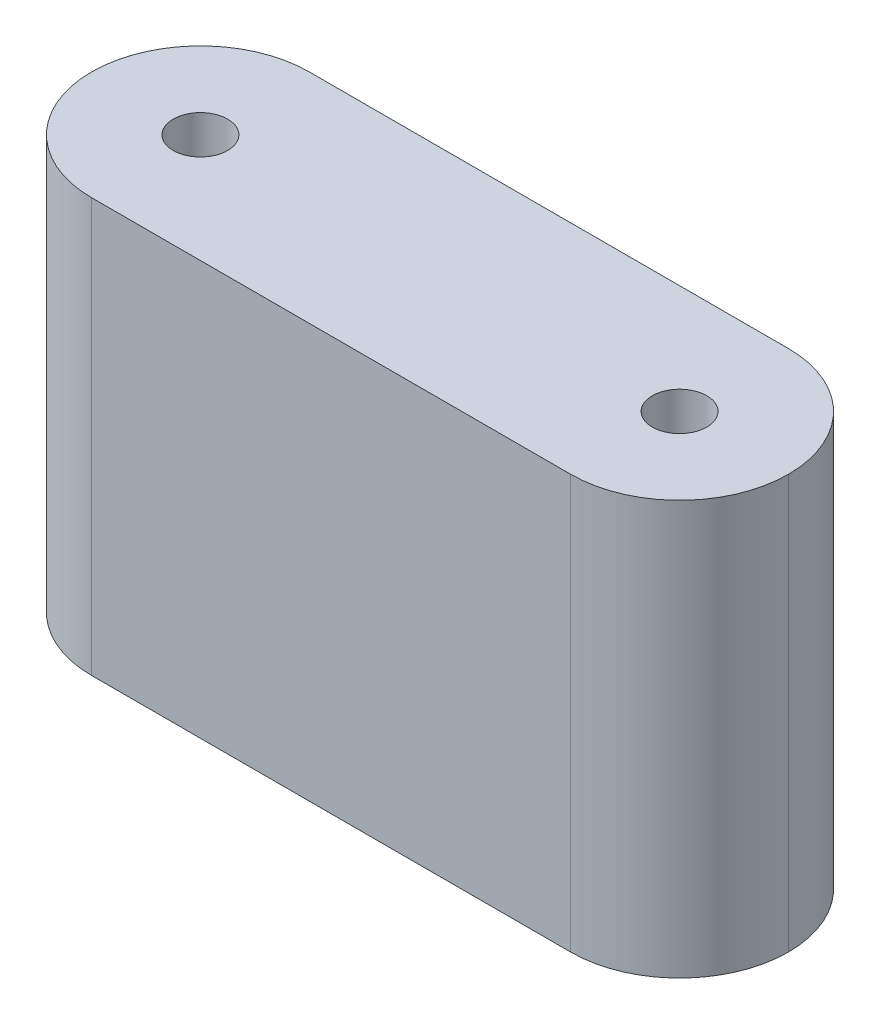
from build123d import *

# Parameters (mm, degrees)
SKETCH_1_W      = 32
SKETCH_1_H      = 10
SKETCH_1_R      = 1.25
EXTRUDE_1_DEPTH = 18
SKETCH_4_W      = 32
SKETCH_4_H      = 10
SKETCH_4_R      = 1.25
EXTRUDE_3_DEPTH = 1
FILLET_3_R      = 5
FILLET_4_R      = 5


with BuildPart() as part:
    # 草图1 → 凸台-拉伸1 (new body)
    with BuildSketch(Plane(origin=(0, 0, 0), x_dir=(1, 0, 0), z_dir=(0, 1, 0))):
        with Locations((16, 5)):
            Rectangle(SKETCH_1_W, SKETCH_1_H)
        with Locations(Location((5, 5, 0), (0, 0, 270))):
            Circle(SKETCH_1_R, mode=Mode.SUBTRACT)
        with Locations(Location((27, 5, 0), (0, 0, 270))):
            Circle(SKETCH_1_R, mode=Mode.SUBTRACT)
    extrude(amount=EXTRUDE_1_DEPTH)

    # 草图4 → 凸台-拉伸3 (add)
    with BuildSketch(Plane(origin=(0, 18, 0), x_dir=(1, 0, 0), z_dir=(0, 1, 0))):
        with Locations((16, 5)):
            Rectangle(SKETCH_4_W, SKETCH_4_H)
        with Locations(Location((5, 5, 0), (0, 0, 270))):
            Circle(SKETCH_4_R, mode=Mode.SUBTRACT)
        with Locations(Location((27, 5, 0), (0, 0, 270))):
            Circle(SKETCH_4_R, mode=Mode.SUBTRACT)
    extrude(amount=EXTRUDE_3_DEPTH)

    # 圆角3
    fillet_3_edges = [part.edges().sort_by_distance(p)[0] for p in [
        (0, 9.5, -10),
    ]]
    fillet(fillet_3_edges, radius=FILLET_3_R)

    # 圆角4
    fillet_4_edges = [part.edges().sort_by_distance(p)[0] for p in [
        (32, 9.5, -10),
        (32, 9.5, 0),
        (0, 9.5, 0),
    ]]
    fillet(fillet_4_edges, radius=FILLET_4_R - 0.0001)  # a hair under: the kernel refuses the full size


solid = part.part
